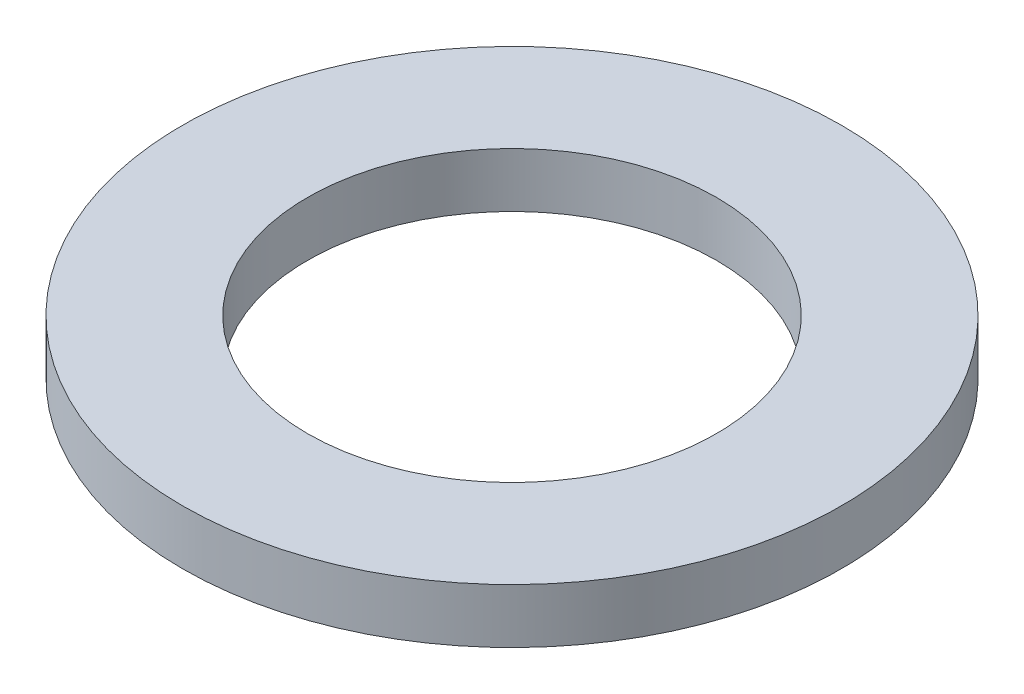
from build123d import *

# Parameters (mm, degrees)
SKETCH1_R           = 72.5
BOSS_EXTRUDE1_DEPTH = 12
SKETCH2_R           = 45
CUT_EXTRUDE1_DEPTH  = 104.230325002


with BuildPart() as part:
    # Sketch1 → Boss-Extrude1 (new body)
    with BuildSketch(Plane(origin=(0, 0, 0), x_dir=(1, 0, 0), z_dir=(0, 1, 0))):
        Circle(SKETCH1_R)
    extrude(amount=BOSS_EXTRUDE1_DEPTH)

    # Sketch2 → Cut-Extrude1 (cut, through all)
    with BuildSketch(Plane(origin=(0, 0, 0), x_dir=(1, 0, 0), z_dir=(0, 1, 0))):
        Circle(SKETCH2_R)
    extrude(amount=CUT_EXTRUDE1_DEPTH, mode=Mode.SUBTRACT)


solid = part.part
